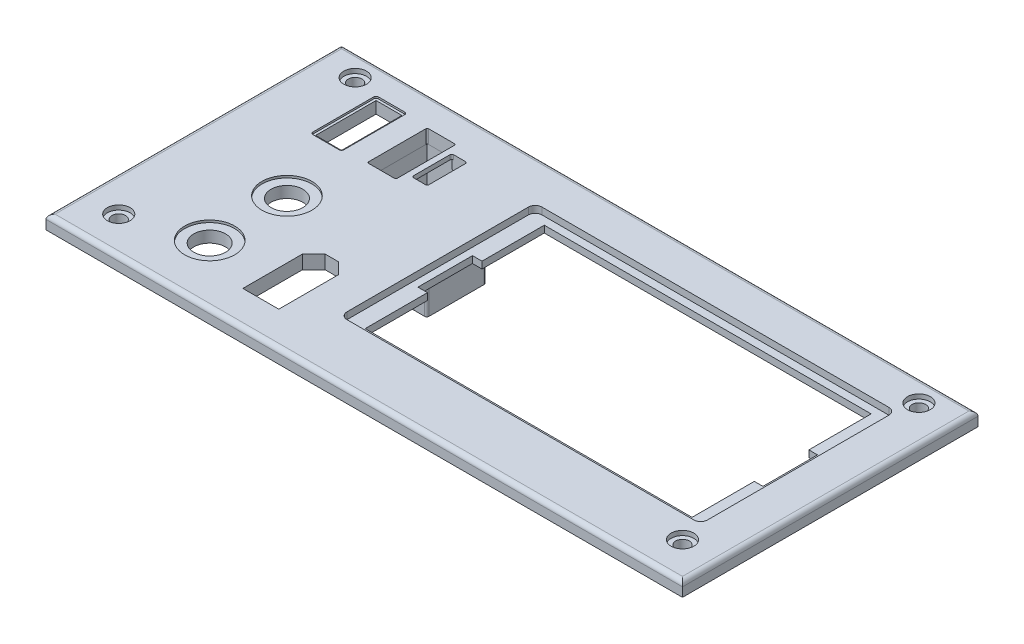
from build123d import *

# Parameters (mm, degrees)
SKETCH_1_W             = 140
SKETCH_1_H             = 65
EXTRUDE_307_DEPTH      = 3
SKETCH_2_W             = 79.3
SKETCH_2_H             = 42.9
CUT_EXTRUDE_542_DEPTH  = 1.5
FILLET_597_R           = 1.5
SKETCH_3_W             = 71.9
SKETCH_3_H             = 39.4
CUT_EXTRUDE_1214_DEPTH = 3
SKETCH_4_W             = 4.2
SKETCH_4_H             = 12
CUT_EXTRUDE_1603_DEPTH = 3
SKETCH_5_R             = 5.5
CUT_EXTRUDE_1905_DEPTH = 0.5
SKETCH_6_R             = 3.5
CUT_EXTRUDE_2045_DEPTH = 3
SKETCH_7_W             = 6.8
SKETCH_7_H             = 14.4
USB_DEPTH              = 0.4
SKETCH_8_W             = 5.7
SKETCH_8_H             = 13.3
USB_2_DEPTH            = 3
F_1_USB_R              = 0.5
XT60_DEPTH             = 88.372764635
SKETCH_10_R            = 1.5
CUT_EXTRUDE_4241_DEPTH = 88.372764635
SKETCH_13_R            = 2.5
CUT_EXTRUDE_4755_DEPTH = 1
FILLET_1_R             = 1
CUT_EXTRUDE_1_DEPTH    = 3
FILLET_2_R             = 0.4
FILLET_3_R             = 0.3
SKETCH_15_W            = 1.3
SKETCH_15_H            = 18.4
EXTRUDE_1_DEPTH        = 1
FILLET_4_R             = 0.3
FILLET_5_R             = 0.4
EXTRUDE_1_2_DEPTH      = 20
FILLET_6_R             = 0.5


with BuildPart() as part:
    # Sketch 1 → Extrude 307 (new body)
    with BuildSketch(Plane(origin=(0, 0, 0), x_dir=(1, 0, 0), z_dir=(0, 1, 0))):
        with Locations((10, -2.5)):
            Rectangle(SKETCH_1_W, SKETCH_1_H)
    extrude(amount=EXTRUDE_307_DEPTH)

    # Sketch 2 → Cut-Extrude 542 (cut)
    with BuildSketch(Plane(origin=(0, 3, 0), x_dir=(1, 0, 0), z_dir=(0, 1, 0))):
        with Locations((31.35, -0.55)):
            Rectangle(SKETCH_2_W, SKETCH_2_H)
    extrude(amount=-CUT_EXTRUDE_542_DEPTH, mode=Mode.SUBTRACT)

    # Fillet 597
    fillet_597_edges = [part.edges().sort_by_distance(p)[0] for p in [
        (71, 2.25, 22),
        (-8.3, 2.25, 22),
        (71, 2.25, -20.9),
        (-8.3, 2.25, -20.9),
    ]]
    fillet(fillet_597_edges, radius=FILLET_597_R)

    # Sketch 3 → Cut-Extrude 1214 (cut)
    with BuildSketch(Plane(origin=(0, 1.5, 0), x_dir=(1, 0, 0), z_dir=(0, 1, 0))):
        with Locations((31.35, -0.5)):
            Rectangle(SKETCH_3_W, SKETCH_3_H)
    extrude(amount=-CUT_EXTRUDE_1214_DEPTH, mode=Mode.SUBTRACT)

    # Sketch 4 → Cut-Extrude 1603 (cut)
    with BuildSketch(Plane(origin=(0, 1.5, 0), x_dir=(1, 0, 0), z_dir=(0, 1, 0))):
        with Locations((-4.6, -0.5)):
            Rectangle(SKETCH_4_W, SKETCH_4_H)
        with Locations((67.1, -0.5)):
            Rectangle(SKETCH_4_W, SKETCH_4_H)
    extrude(amount=-CUT_EXTRUDE_1603_DEPTH, mode=Mode.SUBTRACT)

    # Sketch 5 → Cut-Extrude 1905 (cut)
    with BuildSketch(Plane(origin=(0, 3, 0), x_dir=(1, 0, 0), z_dir=(0, 1, 0))):
        with Locations((-37, -5)):
            Circle(SKETCH_5_R)
        with Locations((-37, -22)):
            Circle(SKETCH_5_R)
    extrude(amount=-CUT_EXTRUDE_1905_DEPTH, mode=Mode.SUBTRACT)

    # Sketch 6 → Cut-Extrude 2045 (cut)
    with BuildSketch(Plane(origin=(0, 2.5, 0), x_dir=(1, 0, 0), z_dir=(0, 1, 0))):
        with Locations((-37, -5)):
            Circle(SKETCH_6_R)
        with Locations((-37, -22)):
            Circle(SKETCH_6_R)
    extrude(amount=-CUT_EXTRUDE_2045_DEPTH, mode=Mode.SUBTRACT)

    # Sketch 7 → USB (cut)
    with BuildSketch(Plane(origin=(0, 3, 0), x_dir=(1, 0, 0), z_dir=(0, 1, 0))):
        with Locations((-42.9, 16.7)):
            Rectangle(SKETCH_7_W, SKETCH_7_H)
    extrude(amount=-USB_DEPTH, mode=Mode.SUBTRACT)

    # Sketch 8 → USB 2 (cut)
    with BuildSketch(Plane(origin=(0, 2.6, 0), x_dir=(1, 0, 0), z_dir=(0, 1, 0))):
        with Locations((-42.9, 16.7)):
            Rectangle(SKETCH_8_W, SKETCH_8_H)
    extrude(amount=-USB_2_DEPTH, mode=Mode.SUBTRACT)

    # 1 USB
    f_1_usb_edges = [part.edges().sort_by_distance(p)[0] for p in [
        (-46.3, 2.8, -9.5),
        (-39.5, 2.8, -9.5),
        (-39.5, 2.8, -23.9),
        (-46.3, 2.8, -23.9),
    ]]
    fillet(f_1_usb_edges, radius=F_1_USB_R)

    # Sketch 9 → XT60 (cut, through all)
    with BuildSketch(Plane(origin=(0, 3, 0), x_dir=(1, 0, 0), z_dir=(0, 1, 0))):
        Polygon((-24.2, -27.5), (-16.3, -27.5), (-16.3, -14.4), (-18.8, -11.9), (-21.7, -11.9), (-24.2, -14.4), align=None)
    extrude(amount=-XT60_DEPTH, mode=Mode.SUBTRACT)

    # Sketch 10 → Cut-Extrude 4241 (cut, through all)
    with BuildSketch(Plane(origin=(0, 3, 0), x_dir=(1, 0, 0), z_dir=(0, 1, 0))):
        with Locations((-52, 25)):
            Circle(SKETCH_10_R)
        with Locations((72, 25)):
            Circle(SKETCH_10_R)
        with Locations((72, -27)):
            Circle(SKETCH_10_R)
        with Locations((-52, -27)):
            Circle(SKETCH_10_R)
    extrude(amount=-CUT_EXTRUDE_4241_DEPTH, mode=Mode.SUBTRACT)

    # Sketch 13 → Cut-Extrude 4755 (cut)
    with BuildSketch(Plane(origin=(0, 3, 0), x_dir=(1, 0, 0), z_dir=(0, 1, 0))):
        with Locations((-52, 25)):
            Circle(SKETCH_13_R)
        with Locations((72, 25)):
            Circle(SKETCH_13_R)
        with Locations((72, -27)):
            Circle(SKETCH_13_R)
        with Locations((-52, -27)):
            Circle(SKETCH_13_R)
    extrude(amount=-CUT_EXTRUDE_4755_DEPTH, mode=Mode.SUBTRACT)

    # Fillet 1
    fillet_1_edges = [part.edges().sort_by_distance(p)[0] for p in [
        (10, 3, 35),
        (80, 3, 2.5),
        (-60, 3, 2.5),
        (10, 3, -30),
    ]]
    fillet(fillet_1_edges, radius=FILLET_1_R)

    # Sketch 14 → Cut-Extrude 1 (cut)
    with BuildSketch(Plane(origin=(0, 3, 0), x_dir=(1, 0, 0), z_dir=(0, 1, 0))):
        Polygon((-28.2, 10.15), (-34.5, 10.15), (-34.5, 23.35), (-28.2, 23.35), (-28.2, 25.9), (-26.9, 25.89999993), (-26.9, 21.14999993), (-23.5, 21.14999993), (-23.5, 12.34999993), (-26.9, 12.34999993), (-26.9, 7.59999993), (-28.2, 7.6), align=None)
    extrude(amount=-CUT_EXTRUDE_1_DEPTH, mode=Mode.SUBTRACT)

    # Fillet 2
    fillet_2_edges = [part.edges().sort_by_distance(p)[0] for p in [
        (-23.5, 1.5, -12.34999993),
        (-23.5, 1.5, -21.14999993),
    ]]
    fillet(fillet_2_edges, radius=FILLET_2_R)

    # Fillet 3
    fillet_3_edges = [part.edges().sort_by_distance(p)[0] for p in [
        (-34.5, 1.5, -10.15),
        (-34.5, 1.5, -23.35),
    ]]
    fillet(fillet_3_edges, radius=FILLET_3_R)

    # Sketch 15 → Extrude 1 (add)
    with BuildSketch(Plane(origin=(0, 3, 0), x_dir=(1, 0, 0), z_dir=(0, 1, 0))):
        with Locations((-27.55, 16.799999965)):
            Rectangle(SKETCH_15_W, SKETCH_15_H)
    extrude(amount=-EXTRUDE_1_DEPTH)

    # Fillet 4
    fillet_4_edges = [part.edges().sort_by_distance(p)[0] for p in [
        (-28.2, 2.5, -10.15),
        (-28.2, 2.5, -23.35),
    ]]
    fillet(fillet_4_edges, radius=FILLET_4_R)

    # Fillet 5
    fillet_5_edges = [part.edges().sort_by_distance(p)[0] for p in [
        (-26.9, 2.5, -12.34999993),
        (-26.9, 2.5, -21.14999993),
    ]]
    fillet(fillet_5_edges, radius=FILLET_5_R)

    # Sketch 17 → Extrude 1 2 (add)
    with BuildSketch(Plane.XZ):
        Polygon((-36.618386658, -7.996110769), (-30.309338786, -7.996110769), (-30.309338786, -5.553278209), (-24.770546623, -5.553278209), (-24.770546623, -10.1696547), (-21.404438764, -10.1696547), (-21.404438764, -23.245547993), (-24.770546623, -23.245547993), (-24.770546623, -27.954623035), (-30.309338786, -27.954623035), (-30.309338786, -25.408557701), (-36.618386658, -25.408557701), align=None)
        Polygon((-34.618386658, -9.996110769), (-28.309338786, -9.996110769), (-28.309338786, -7.553278209), (-26.770546623, -7.553278209), (-26.770546623, -12.1696547), (-23.404438764, -12.1696547), (-23.404438764, -21.245547993), (-26.770546623, -21.245547993), (-26.770546623, -25.954623035), (-28.309338786, -25.954623035), (-28.309338786, -23.408557701), (-34.618386658, -23.408557701), align=None, mode=Mode.SUBTRACT)
    extrude(amount=EXTRUDE_1_2_DEPTH)

    # Fillet 6
    fillet_6_edges = [part.edges().sort_by_distance(p)[0] for p in [
        (-24.770546623, -10, -23.245547993),
        (-24.770546623, -10, -27.954623035),
        (-30.309338786, -10, -27.954623035),
        (-30.309338786, -10, -25.408557701),
        (-36.618386658, -10, -25.408557701),
        (-36.618386658, -10, -7.996110769),
        (-30.309338786, -10, -7.996110769),
        (-30.309338786, -10, -5.553278209),
        (-21.404438764, -10, -23.245547993),
        (-24.770546623, -10, -10.1696547),
        (-21.404438764, -10, -10.1696547),
        (-24.770546623, -10, -5.553278209),
    ]]
    fillet(fillet_6_edges, radius=FILLET_6_R)


solid = part.part
